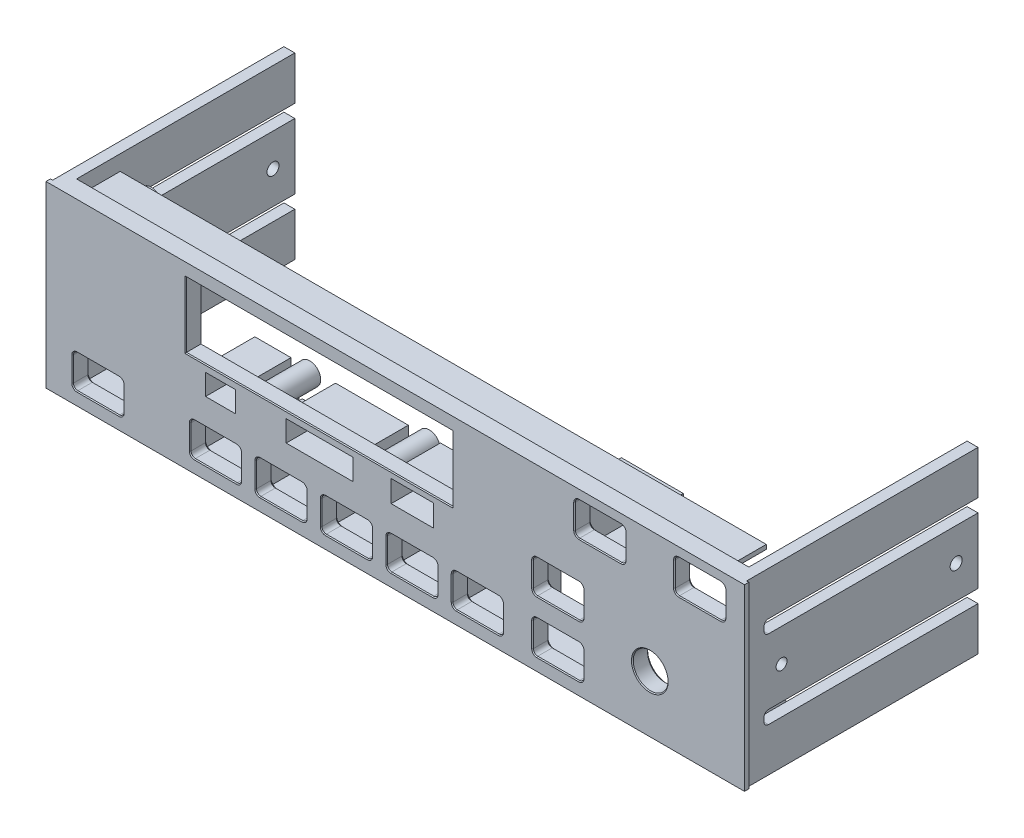
from build123d import *

# Parameters (mm, degrees)
ESQUISSE1_W             = 160
ESQUISSE1_H             = 41
BOSS_EXTRU_1_DEPTH      = 4
ESQUISSE2_R             = 4
ENL_V_MAT_EXTRU_1_DEPTH = 4
ESQUISSE4_W             = 3
ESQUISSE4_H             = 41
BOSS_EXTRU_2_DEPTH      = 50
ENL_V_MAT_EXTRU_2_DEPTH = 173.571724219
CHANFREIN1_SIZE         = 0.2
ESQUISSE9_R             = 1.25
ESQUISSE9_R_2           = 1.375
ENL_V_MAT_EXTRU_3_DEPTH = 900
ENL_V_START             = -1
ESQUISSE10_W            = 4.171279912
ESQUISSE10_H            = 57.921201065
ESQUISSE10_W_2          = 8.342559824
ESQUISSE10_H_2          = 64.595248924
ENL_V_MAT_EXTRU_5_DEPTH = 173.772840225
ESQUISSE11_W            = 14.2
ESQUISSE11_H            = 13.6
ESQUISSE11_W_2          = 12.8
ESQUISSE11_H_2          = 12.2
BOSS_EXTRU_4_DEPTH      = 8
ESQUISSE7_R             = 2.5
ESQUISSE7_R_2           = 1.25
BOSS_EXTRU_3_DEPTH      = 11
ESQUISSE7_3_R           = 2.5
ESQUISSE7_3_R_2         = 1.25
BOSS_EXTRU_12_DEPTH     = 10.5
ESQUISSE12_W            = 148
ESQUISSE12_H            = 1
BOSS_EXTRU_5_DEPTH      = 7
ESQUISSE14_W            = 8.279282425
ESQUISSE14_H            = 6.197970863
ESQUISSE14_W_2          = 6.879282425
ESQUISSE14_H_2          = 4.797970863
ESQUISSE14_W_3          = 16.678738338
ESQUISSE14_H_3          = 6.241410903
ESQUISSE14_W_4          = 15.278738338
ESQUISSE14_H_4          = 4.841410903
ESQUISSE14_W_5          = 11.14782764
ESQUISSE14_H_5          = 6.395979727
ESQUISSE14_W_6          = 9.74782764
ESQUISSE14_H_6          = 4.995979727
BOSS_EXTRU_7_DEPTH      = 8
ESQUISSE15_W            = 9.74782764
ESQUISSE15_H            = 4.995979727
ESQUISSE15_W_2          = 15.278738338
ESQUISSE15_H_2          = 4.841410903
ESQUISSE15_W_3          = 6.879282425
ESQUISSE15_H_3          = 4.797970863
ENL_V_MAT_EXTRU_7_DEPTH = 3.7
CHANFREIN2_SIZE         = 0.5
ESQUISSE16_W            = 6.879282425
ESQUISSE16_H            = 4.797970863
ESQUISSE16_W_2          = 15.278738338
ESQUISSE16_H_2          = 4.841410903
ESQUISSE16_W_3          = 9.74782764
ESQUISSE16_H_3          = 4.995979727
ENL_V_MAT_EXTRU_8_DEPTH = 10


with BuildPart() as part:
    # Esquisse1 → Boss.-Extru.1 (new body)
    with BuildSketch(Plane.XY):
        with Locations((80, 20.5)):
            Rectangle(ESQUISSE1_W, ESQUISSE1_H)
    extrude(amount=BOSS_EXTRU_1_DEPTH)

    # Esquisse2 → Enlèv. mat.-Extru.1 (cut)
    with BuildSketch(Plane.XY.offset(4)):
        with Locations((138.32, 13)):
            Circle(ESQUISSE2_R)
        with BuildLine():
            Line((7.1, 2.95), (16.7, 2.95))
            ThreePointArc((16.7, 2.95), (17.407106781, 3.242893219), (17.7, 3.95))
            Line((17.7, 3.95), (17.7, 9.55))
            ThreePointArc((17.7, 9.55), (17.407106781, 10.257106781), (16.7, 10.55))
            Line((16.7, 10.55), (7.1, 10.55))
            ThreePointArc((7.1, 10.55), (6.392893219, 10.257106781), (6.1, 9.55))
            Line((6.1, 9.55), (6.1, 3.95))
            ThreePointArc((6.1, 3.95), (6.392893219, 3.242893219), (7.1, 2.95))
        make_face()
        with BuildLine():
            Line((49.030194036, 10.55), (58.630194036, 10.55))
            ThreePointArc((58.630194036, 10.55), (59.337300817, 10.257106781), (59.630194036, 9.55))
            Line((59.630194036, 9.55), (59.630194036, 3.95))
            ThreePointArc((59.630194036, 3.95), (59.337300817, 3.242893219), (58.630194036, 2.95))
            Line((58.630194036, 2.95), (49.030194036, 2.95))
            ThreePointArc((49.030194036, 2.95), (48.323087255, 3.242893219), (48.030194036, 3.95))
            Line((48.030194036, 3.95), (48.030194036, 9.55))
            ThreePointArc((48.030194036, 9.55), (48.323087255, 10.257106781), (49.030194036, 10.55))
        make_face()
        with BuildLine():
            Line((34.030194036, 10.55), (43.630194036, 10.55))
            ThreePointArc((43.630194036, 10.55), (44.337300817, 10.257106781), (44.630194036, 9.55))
            Line((44.630194036, 9.55), (44.630194036, 3.95))
            ThreePointArc((44.630194036, 3.95), (44.337300817, 3.242893219), (43.630194036, 2.95))
            Line((43.630194036, 2.95), (34.030194036, 2.95))
            ThreePointArc((34.030194036, 2.95), (33.323087255, 3.242893219), (33.030194036, 3.95))
            Line((33.030194036, 3.95), (33.030194036, 9.55))
            ThreePointArc((33.030194036, 9.55), (33.323087255, 10.257106781), (34.030194036, 10.55))
        make_face()
        with BuildLine():
            Line((64.030194036, 10.55), (73.630194036, 10.55))
            ThreePointArc((73.630194036, 10.55), (74.337300817, 10.257106781), (74.630194036, 9.55))
            Line((74.630194036, 9.55), (74.630194036, 3.95))
            ThreePointArc((74.630194036, 3.95), (74.337300817, 3.242893219), (73.630194036, 2.95))
            Line((73.630194036, 2.95), (64.030194036, 2.95))
            ThreePointArc((64.030194036, 2.95), (63.323087255, 3.242893219), (63.030194036, 3.95))
            Line((63.030194036, 3.95), (63.030194036, 9.55))
            ThreePointArc((63.030194036, 9.55), (63.323087255, 10.257106781), (64.030194036, 10.55))
        make_face()
        with BuildLine():
            Line((79.030194036, 10.55), (88.630194036, 10.55))
            ThreePointArc((88.630194036, 10.55), (89.337300817, 10.257106781), (89.630194036, 9.55))
            Line((89.630194036, 9.55), (89.630194036, 3.95))
            ThreePointArc((89.630194036, 3.95), (89.337300817, 3.242893219), (88.630194036, 2.95))
            Line((88.630194036, 2.95), (79.030194036, 2.95))
            ThreePointArc((79.030194036, 2.95), (78.323087255, 3.242893219), (78.030194036, 3.95))
            Line((78.030194036, 3.95), (78.030194036, 9.55))
            ThreePointArc((78.030194036, 9.55), (78.323087255, 10.257106781), (79.030194036, 10.55))
        make_face()
        with BuildLine():
            Line((112.45409437, 10.55), (122.05409437, 10.55))
            ThreePointArc((122.05409437, 10.55), (122.761201151, 10.257106781), (123.05409437, 9.55))
            Line((123.05409437, 9.55), (123.05409437, 3.95))
            ThreePointArc((123.05409437, 3.95), (122.761201151, 3.242893219), (122.05409437, 2.95))
            Line((122.05409437, 2.95), (112.45409437, 2.95))
            ThreePointArc((112.45409437, 2.95), (111.746987589, 3.242893219), (111.45409437, 3.95))
            Line((111.45409437, 3.95), (111.45409437, 9.55))
            ThreePointArc((111.45409437, 9.55), (111.746987589, 10.257106781), (112.45409437, 10.55))
        make_face()
        with BuildLine():
            Line((122.089585492, 31.2), (131.689585492, 31.2))
            ThreePointArc((131.689585492, 31.2), (132.396692273, 31.492893219), (132.689585492, 32.2))
            Line((132.689585492, 32.2), (132.689585492, 37.8))
            ThreePointArc((132.689585492, 37.8), (132.396692273, 38.507106781), (131.689585492, 38.8))
            Line((131.689585492, 38.8), (122.089585492, 38.8))
            ThreePointArc((122.089585492, 38.8), (121.382478711, 38.507106781), (121.089585492, 37.8))
            Line((121.089585492, 37.8), (121.089585492, 32.2))
            ThreePointArc((121.089585492, 32.2), (121.382478711, 31.492893219), (122.089585492, 31.2))
        make_face()
        with BuildLine():
            Line((144.95, 31.2), (154.55, 31.2))
            ThreePointArc((154.55, 31.2), (155.257106781, 31.492893219), (155.55, 32.2))
            Line((155.55, 32.2), (155.55, 37.8))
            ThreePointArc((155.55, 37.8), (155.257106781, 38.507106781), (154.55, 38.8))
            Line((154.55, 38.8), (144.95, 38.8))
            ThreePointArc((144.95, 38.8), (144.242893219, 38.507106781), (143.95, 37.8))
            Line((143.95, 37.8), (143.95, 32.2))
            ThreePointArc((143.95, 32.2), (144.242893219, 31.492893219), (144.95, 31.2))
        make_face()
        with BuildLine():
            Line((112.45409437, 22.55), (122.05409437, 22.55))
            ThreePointArc((122.05409437, 22.55), (122.761201151, 22.257106781), (123.05409437, 21.55))
            Line((123.05409437, 21.55), (123.05409437, 15.95))
            ThreePointArc((123.05409437, 15.95), (122.761201151, 15.242893219), (122.05409437, 14.95))
            Line((122.05409437, 14.95), (112.45409437, 14.95))
            ThreePointArc((112.45409437, 14.95), (111.746987589, 15.242893219), (111.45409437, 15.95))
            Line((111.45409437, 15.95), (111.45409437, 21.55))
            ThreePointArc((111.45409437, 21.55), (111.746987589, 22.257106781), (112.45409437, 22.55))
        make_face()
        Polygon((32, 38), (63.5, 38), (93, 38), (93, 23), (63.5, 23), (32, 23), align=None)
        with BuildLine():
            Line((94.030194036, 10.55), (103.630194036, 10.55))
            ThreePointArc((103.630194036, 10.55), (104.337300817, 10.257106781), (104.630194036, 9.55))
            Line((104.630194036, 9.55), (104.630194036, 3.95))
            ThreePointArc((104.630194036, 3.95), (104.337300817, 3.242893219), (103.630194036, 2.95))
            Line((103.630194036, 2.95), (94.030194036, 2.95))
            ThreePointArc((94.030194036, 2.95), (93.323087255, 3.242893219), (93.030194036, 3.95))
            Line((93.030194036, 3.95), (93.030194036, 9.55))
            ThreePointArc((93.030194036, 9.55), (93.323087255, 10.257106781), (94.030194036, 10.55))
        make_face()
    extrude(amount=-ENL_V_MAT_EXTRU_1_DEPTH, mode=Mode.SUBTRACT)

    # Esquisse4 → Boss.-Extru.2 (add)
    with BuildSketch(Plane(origin=(0, 0, 0), x_dir=(-1, 0, 0), z_dir=(0, 0, -1))):
        with Locations((-158.5, 20.5)):
            Rectangle(ESQUISSE4_W, ESQUISSE4_H)
        with Locations((-1.5, 20.5)):
            Rectangle(ESQUISSE4_W, ESQUISSE4_H)
    extrude(amount=BOSS_EXTRU_2_DEPTH)

    # Esquisse5 → Enlèv. mat.-Extru.2 (cut, through all)
    with BuildSketch(Plane(origin=(160, 0, 0), x_dir=(0, 0, -1), z_dir=(1, 0, 0))):
        with BuildLine():
            Line((50, 13), (2, 13))
            ThreePointArc((2, 13), (1.292893219, 12.707106781), (1, 12))
            Line((1, 12), (1, 11))
            ThreePointArc((1, 11), (1.292893219, 10.292893219), (2, 10))
            Line((2, 10), (50, 10))
            Line((50, 10), (50, 13))
        make_face()
        with BuildLine():
            Line((50, 31), (2, 31))
            ThreePointArc((2, 31), (1.292893219, 30.707106781), (1, 30))
            Line((1, 30), (1, 29))
            ThreePointArc((1, 29), (1.292893219, 28.292893219), (2, 28))
            Line((2, 28), (50, 28))
            Line((50, 28), (50, 31))
        make_face()
    extrude(amount=-ENL_V_MAT_EXTRU_2_DEPTH, mode=Mode.SUBTRACT)

    # Chanfrein1
    chanfrein1_edges = [part.edges().sort_by_distance(p)[0] for p in [
        (93, 30.5, 4),
        (62.5, 23, 4),
        (32, 30.5, 4),
        (62.5, 38, 4),
        (149.75, 31.2, 4),
        (155.257106781, 31.492893219, 4),
        (144.242893219, 31.492893219, 4),
        (155.55, 35, 4),
        (143.95, 35, 4),
        (155.257106781, 38.507106781, 4),
        (144.242893219, 38.507106781, 4),
        (149.75, 38.8, 4),
        (126.889585492, 31.2, 4),
        (132.396692273, 31.492893219, 4),
        (121.382478711, 31.492893219, 4),
        (132.689585492, 35, 4),
        (121.089585492, 35, 4),
        (132.396692273, 38.507106781, 4),
        (121.382478711, 38.507106781, 4),
        (126.889585492, 38.8, 4),
        (11.9, 2.95, 4),
        (17.407106781, 3.242893219, 4),
        (6.392893219, 3.242893219, 4),
        (17.7, 6.75, 4),
        (6.1, 6.75, 4),
        (17.407106781, 10.257106781, 4),
        (6.392893219, 10.257106781, 4),
        (11.9, 10.55, 4),
        (134.32, 13, 4),
        (123.05409437, 18.75, 4),
        (122.761201151, 22.257106781, 4),
        (122.761201151, 15.242893219, 4),
        (117.25409437, 22.55, 4),
        (117.25409437, 14.95, 4),
        (111.746987589, 22.257106781, 4),
        (111.746987589, 15.242893219, 4),
        (111.45409437, 18.75, 4),
        (123.05409437, 6.75, 4),
        (122.761201151, 10.257106781, 4),
        (122.761201151, 3.242893219, 4),
        (117.25409437, 10.55, 4),
        (117.25409437, 2.95, 4),
        (111.746987589, 10.257106781, 4),
        (111.746987589, 3.242893219, 4),
        (111.45409437, 6.75, 4),
        (104.630194036, 6.75, 4),
        (104.337300817, 10.257106781, 4),
        (104.337300817, 3.242893219, 4),
        (98.830194036, 10.55, 4),
        (98.830194036, 2.95, 4),
        (93.323087255, 10.257106781, 4),
        (93.323087255, 3.242893219, 4),
        (93.030194036, 6.75, 4),
        (89.630194036, 6.75, 4),
        (89.337300817, 10.257106781, 4),
        (89.337300817, 3.242893219, 4),
        (83.830194036, 10.55, 4),
        (83.830194036, 2.95, 4),
        (78.323087255, 10.257106781, 4),
        (78.323087255, 3.242893219, 4),
        (78.030194036, 6.75, 4),
        (74.630194036, 6.75, 4),
        (74.337300817, 10.257106781, 4),
        (74.337300817, 3.242893219, 4),
        (68.830194036, 10.55, 4),
        (68.830194036, 2.95, 4),
        (63.323087255, 10.257106781, 4),
        (63.323087255, 3.242893219, 4),
        (63.030194036, 6.75, 4),
        (59.630194036, 6.75, 4),
        (59.337300817, 10.257106781, 4),
        (59.337300817, 3.242893219, 4),
        (53.830194036, 10.55, 4),
        (53.830194036, 2.95, 4),
        (48.323087255, 10.257106781, 4),
        (48.323087255, 3.242893219, 4),
        (48.030194036, 6.75, 4),
        (44.630194036, 6.75, 4),
        (44.337300817, 10.257106781, 4),
        (44.337300817, 3.242893219, 4),
        (38.830194036, 10.55, 4),
        (38.830194036, 2.95, 4),
        (33.323087255, 10.257106781, 4),
        (33.323087255, 3.242893219, 4),
        (33.030194036, 6.75, 4),
    ]]
    chamfer(chanfrein1_edges, length=CHANFREIN1_SIZE)

    # Esquisse9 → Enlèv. mat.-Extru.3 (cut)
    with BuildSketch(Plane(origin=(160, 0, 0), x_dir=(0, 0, -1), z_dir=(1, 0, 0))):
        with Locations((5, 20.5)):
            Circle(ESQUISSE9_R)
        with Locations((45, 20.5)):
            Circle(ESQUISSE9_R_2)
    extrude(amount=-ENL_V_MAT_EXTRU_3_DEPTH, mode=Mode.SUBTRACT)

    # Esquisse10 → Enlèv. mat.-Extru.5 (cut, through all)
    with BuildSketch(Plane.XY.offset(4).offset(ENL_V_START)):
        with Locations((-1.585639956, 24.108169502)):
            Rectangle(ESQUISSE10_W, ESQUISSE10_H)
        with Locations((163.671279912, 22.797195815)):
            Rectangle(ESQUISSE10_W_2, ESQUISSE10_H_2)
    extrude(amount=-ENL_V_MAT_EXTRU_5_DEPTH, mode=Mode.SUBTRACT)

    # Esquisse11 → Boss.-Extru.4 (add)
    # profile 1 of 7: a face of its own
    with BuildSketch(Plane(origin=(0, 0, 0), x_dir=(-1, 0, 0), z_dir=(0, 0, -1))):
        with Locations((-11.9, 8.45)):
            Rectangle(ESQUISSE11_W, ESQUISSE11_H)
        with Locations((-11.9, 8.45)):
            Rectangle(ESQUISSE11_W_2, ESQUISSE11_H_2, mode=Mode.SUBTRACT)
    # profile 2 of 7: a face of its own
    with BuildSketch(Plane(origin=(0, 0, 0), x_dir=(-1, 0, 0), z_dir=(0, 0, -1))):
        with Locations((-38.830194036, 8.45)):
            Rectangle(ESQUISSE11_W, ESQUISSE11_H)
        with Locations((-38.830194036, 8.45)):
            Rectangle(ESQUISSE11_W_2, ESQUISSE11_H_2, mode=Mode.SUBTRACT)
    # profile 3 of 7: a face of its own
    with BuildSketch(Plane(origin=(0, 0, 0), x_dir=(-1, 0, 0), z_dir=(0, 0, -1))):
        with Locations((-53.830194036, 8.45)):
            Rectangle(ESQUISSE11_W, ESQUISSE11_H)
        with Locations((-53.830194036, 8.45)):
            Rectangle(ESQUISSE11_W_2, ESQUISSE11_H_2, mode=Mode.SUBTRACT)
    # profile 4 of 7: a face of its own
    with BuildSketch(Plane(origin=(0, 0, 0), x_dir=(-1, 0, 0), z_dir=(0, 0, -1))):
        with Locations((-68.830194036, 8.45)):
            Rectangle(ESQUISSE11_W, ESQUISSE11_H)
        with Locations((-68.830194036, 8.45)):
            Rectangle(ESQUISSE11_W_2, ESQUISSE11_H_2, mode=Mode.SUBTRACT)
    # profile 5 of 7: a face of its own
    with BuildSketch(Plane(origin=(0, 0, 0), x_dir=(-1, 0, 0), z_dir=(0, 0, -1))):
        with Locations((-83.830194036, 8.45)):
            Rectangle(ESQUISSE11_W, ESQUISSE11_H)
        with Locations((-83.830194036, 8.45)):
            Rectangle(ESQUISSE11_W_2, ESQUISSE11_H_2, mode=Mode.SUBTRACT)
    # profile 6 of 7: a face of its own
    with BuildSketch(Plane(origin=(0, 0, 0), x_dir=(-1, 0, 0), z_dir=(0, 0, -1))):
        with Locations((-98.830194036, 8.45)):
            Rectangle(ESQUISSE11_W, ESQUISSE11_H)
        with Locations((-98.830194036, 8.45)):
            Rectangle(ESQUISSE11_W_2, ESQUISSE11_H_2, mode=Mode.SUBTRACT)
    # profile 7 of 7: a face of its own
    with BuildSketch(Plane(origin=(0, 0, 0), x_dir=(-1, 0, 0), z_dir=(0, 0, -1))):
        with Locations((-126.889585492, 33.3)):
            Rectangle(ESQUISSE11_W, ESQUISSE11_H)
        with Locations((-126.889585492, 33.3)):
            Rectangle(ESQUISSE11_W_2, ESQUISSE11_H_2, mode=Mode.SUBTRACT)
    extrude(amount=BOSS_EXTRU_4_DEPTH)

    # Esquisse7 → Boss.-Extru.3 (add)
    # profile 1 of 4: a face of its own
    with BuildSketch(Plane(origin=(0, 0, 0), x_dir=(-1, 0, 0), z_dir=(0, 0, -1))):
        with Locations((-9.121504758, 34.424873109)):
            Circle(ESQUISSE7_R)
        with Locations((-9.121504758, 34.424873109)):
            Circle(ESQUISSE7_R_2, mode=Mode.SUBTRACT)
    # profile 2 of 4: a face of its own
    with BuildSketch(Plane(origin=(0, 0, 0), x_dir=(-1, 0, 0), z_dir=(0, 0, -1))):
        with Locations((-24.98168427, 6.75)):
            Circle(ESQUISSE7_R)
        with Locations((-24.98168427, 6.75)):
            Circle(ESQUISSE7_R_2, mode=Mode.SUBTRACT)
    # profile 3 of 4: a face of its own
    with BuildSketch(Plane(origin=(0, 0, 0), x_dir=(-1, 0, 0), z_dir=(0, 0, -1))):
        with Locations((-138.246159037, 33.067084724)):
            Circle(ESQUISSE7_R)
        with Locations((-138.246159037, 33.067084724)):
            Circle(ESQUISSE7_R_2, mode=Mode.SUBTRACT)
    # profile 4 of 4: a face of its own
    with BuildSketch(Plane(origin=(0, 0, 0), x_dir=(-1, 0, 0), z_dir=(0, 0, -1))):
        with Locations((-152.183195484, 6.75)):
            Circle(ESQUISSE7_R)
        with Locations((-152.183195484, 6.75)):
            Circle(ESQUISSE7_R_2, mode=Mode.SUBTRACT)
    extrude(amount=BOSS_EXTRU_3_DEPTH)

    # Esquisse7<3> → Boss.-Extru.12 (add)
    # profile 1 of 7: a face of its own
    with BuildSketch(Plane(origin=(0, 0, 0), x_dir=(-1, 0, 0), z_dir=(0, 0, -1))):
        with Locations((-9.121504758, 34.424873109)):
            Circle(ESQUISSE7_3_R)
        with Locations((-9.121504758, 34.424873109)):
            Circle(ESQUISSE7_3_R_2, mode=Mode.SUBTRACT)
    # profile 2 of 7: a face of its own
    with BuildSketch(Plane(origin=(0, 0, 0), x_dir=(-1, 0, 0), z_dir=(0, 0, -1))):
        with Locations((-24.98168427, 6.75)):
            Circle(ESQUISSE7_3_R)
        with Locations((-24.98168427, 6.75)):
            Circle(ESQUISSE7_3_R_2, mode=Mode.SUBTRACT)
    # profile 3 of 7: a face of its own
    with BuildSketch(Plane(origin=(0, 0, 0), x_dir=(-1, 0, 0), z_dir=(0, 0, -1))):
        with Locations((-138.246159037, 33.067084724)):
            Circle(ESQUISSE7_3_R)
        with Locations((-138.246159037, 33.067084724)):
            Circle(ESQUISSE7_3_R_2, mode=Mode.SUBTRACT)
    # profile 4 of 7: a face of its own
    with BuildSketch(Plane(origin=(0, 0, 0), x_dir=(-1, 0, 0), z_dir=(0, 0, -1))):
        with Locations((-152.183195484, 6.75)):
            Circle(ESQUISSE7_3_R)
        with Locations((-152.183195484, 6.75)):
            Circle(ESQUISSE7_3_R_2, mode=Mode.SUBTRACT)
    # profile 5 of 7: a face of its own
    with BuildSketch(Plane(origin=(0, 0, 0), x_dir=(-1, 0, 0), z_dir=(0, 0, -1))):
        with Locations((-73.299586821, 18.635920155)):
            Circle(ESQUISSE7_3_R)
        with Locations((-73.299586821, 18.635920155)):
            Circle(ESQUISSE7_3_R_2, mode=Mode.SUBTRACT)
    # profile 6 of 7: a face of its own
    with BuildSketch(Plane(origin=(0, 0, 0), x_dir=(-1, 0, 0), z_dir=(0, 0, -1))):
        with Locations((-103.528260194, 18.635920155)):
            Circle(ESQUISSE7_3_R)
        with Locations((-103.528260194, 18.635920155)):
            Circle(ESQUISSE7_3_R_2, mode=Mode.SUBTRACT)
    # profile 7 of 7: a face of its own
    with BuildSketch(Plane(origin=(0, 0, 0), x_dir=(-1, 0, 0), z_dir=(0, 0, -1))):
        with Locations((-45.928753513, 18.635920155)):
            Circle(ESQUISSE7_3_R)
        with Locations((-45.928753513, 18.635920155)):
            Circle(ESQUISSE7_3_R_2, mode=Mode.SUBTRACT)
    extrude(amount=BOSS_EXTRU_12_DEPTH)

    # Esquisse12 → Boss.-Extru.5 (add)
    with BuildSketch(Plane(origin=(0, 0, 0), x_dir=(-1, 0, 0), z_dir=(0, 0, -1))):
        with Locations((-80, 40)):
            Rectangle(ESQUISSE12_W, ESQUISSE12_H)
        with Locations((-80, 1)):
            Rectangle(ESQUISSE12_W, ESQUISSE12_H)
    extrude(amount=BOSS_EXTRU_5_DEPTH)

    # Esquisse14 → Boss.-Extru.7 (add)
    # profile 1 of 3: a face of its own
    with BuildSketch(Plane(origin=(0, 0, 0), x_dir=(-1, 0, 0), z_dir=(0, 0, -1))):
        with Locations((-39.983624666, 19.009843626)):
            Rectangle(ESQUISSE14_W, ESQUISSE14_H)
        with Locations((-39.983624666, 19.009843626)):
            Rectangle(ESQUISSE14_W_2, ESQUISSE14_H_2, mode=Mode.SUBTRACT)
    # profile 2 of 3: a face of its own
    with BuildSketch(Plane(origin=(0, 0, 0), x_dir=(-1, 0, 0), z_dir=(0, 0, -1))):
        with Locations((-62.664411353, 19.031563646)):
            Rectangle(ESQUISSE14_W_3, ESQUISSE14_H_3)
        with Locations((-62.664411353, 19.031563646)):
            Rectangle(ESQUISSE14_W_4, ESQUISSE14_H_4, mode=Mode.SUBTRACT)
    # profile 3 of 3: a face of its own
    with BuildSketch(Plane(origin=(0, 0, 0), x_dir=(-1, 0, 0), z_dir=(0, 0, -1))):
        with Locations((-83.939853259, 19.108848058)):
            Rectangle(ESQUISSE14_W_5, ESQUISSE14_H_5)
        with Locations((-83.939853259, 19.108848058)):
            Rectangle(ESQUISSE14_W_6, ESQUISSE14_H_6, mode=Mode.SUBTRACT)
    extrude(amount=BOSS_EXTRU_7_DEPTH)

    # Esquisse15 → Enlèv. mat.-Extru.7 (cut)
    with BuildSketch(Plane(origin=(0, 0, 0), x_dir=(-1, 0, 0), z_dir=(0, 0, -1))):
        with Locations((-83.939853259, 19.108848058)):
            Rectangle(ESQUISSE15_W, ESQUISSE15_H)
        with Locations((-62.664411353, 19.031563646)):
            Rectangle(ESQUISSE15_W_2, ESQUISSE15_H_2)
        with Locations((-39.983624666, 19.009843626)):
            Rectangle(ESQUISSE15_W_3, ESQUISSE15_H_3)
    extrude(amount=-ENL_V_MAT_EXTRU_7_DEPTH, mode=Mode.SUBTRACT)

    # Chanfrein2
    chanfrein2_edges = [part.edges().sort_by_distance(p)[0] for p in [
        (32, 30.5, 0),
        (62.5, 38, 0),
        (93, 30.5, 0),
        (62.5, 23, 0),
        (11.9, 2.95, 0),
        (17.407106781, 3.242893219, 0),
        (6.392893219, 3.242893219, 0),
        (17.7, 6.75, 0),
        (6.1, 6.75, 0),
        (17.407106781, 10.257106781, 0),
        (6.392893219, 10.257106781, 0),
        (11.9, 10.55, 0),
        (38.830194036, 2.95, 0),
        (44.337300817, 3.242893219, 0),
        (33.323087255, 3.242893219, 0),
        (44.630194036, 6.75, 0),
        (33.030194036, 6.75, 0),
        (44.337300817, 10.257106781, 0),
        (33.323087255, 10.257106781, 0),
        (38.830194036, 10.55, 0),
        (53.830194036, 2.95, 0),
        (59.337300817, 3.242893219, 0),
        (48.323087255, 3.242893219, 0),
        (59.630194036, 6.75, 0),
        (48.030194036, 6.75, 0),
        (59.337300817, 10.257106781, 0),
        (48.323087255, 10.257106781, 0),
        (53.830194036, 10.55, 0),
        (68.830194036, 2.95, 0),
        (74.337300817, 3.242893219, 0),
        (63.323087255, 3.242893219, 0),
        (74.630194036, 6.75, 0),
        (63.030194036, 6.75, 0),
        (74.337300817, 10.257106781, 0),
        (63.323087255, 10.257106781, 0),
        (68.830194036, 10.55, 0),
        (83.830194036, 2.95, 0),
        (89.337300817, 3.242893219, 0),
        (78.323087255, 3.242893219, 0),
        (89.630194036, 6.75, 0),
        (78.030194036, 6.75, 0),
        (89.337300817, 10.257106781, 0),
        (78.323087255, 10.257106781, 0),
        (83.830194036, 10.55, 0),
        (98.830194036, 10.55, 0),
        (93.323087255, 10.257106781, 0),
        (104.337300817, 10.257106781, 0),
        (93.030194036, 6.75, 0),
        (104.630194036, 6.75, 0),
        (93.323087255, 3.242893219, 0),
        (104.337300817, 3.242893219, 0),
        (98.830194036, 2.95, 0),
        (117.25409437, 10.55, 0),
        (111.746987589, 10.257106781, 0),
        (122.761201151, 10.257106781, 0),
        (111.45409437, 6.75, 0),
        (123.05409437, 6.75, 0),
        (111.746987589, 3.242893219, 0),
        (122.761201151, 3.242893219, 0),
        (117.25409437, 2.95, 0),
        (134.32, 13, 0),
        (117.25409437, 22.55, 0),
        (111.746987589, 22.257106781, 0),
        (122.761201151, 22.257106781, 0),
        (111.45409437, 18.75, 0),
        (123.05409437, 18.75, 0),
        (111.746987589, 15.242893219, 0),
        (122.761201151, 15.242893219, 0),
        (117.25409437, 14.95, 0),
        (126.889585492, 38.8, 0),
        (121.382478711, 38.507106781, 0),
        (132.396692273, 38.507106781, 0),
        (121.089585492, 35, 0),
        (132.689585492, 35, 0),
        (121.382478711, 31.492893219, 0),
        (132.396692273, 31.492893219, 0),
        (126.889585492, 31.2, 0),
        (149.75, 38.8, 0),
        (144.242893219, 38.507106781, 0),
        (155.257106781, 38.507106781, 0),
        (143.95, 35, 0),
        (155.55, 35, 0),
        (144.242893219, 31.492893219, 0),
        (155.257106781, 31.492893219, 0),
        (149.75, 31.2, 0),
    ]]
    chamfer(chanfrein2_edges, length=CHANFREIN2_SIZE)

    # Esquisse16 → Enlèv. mat.-Extru.8 (cut)
    with BuildSketch(Plane.XY.offset(4)):
        with Locations((39.983624666, 19.009843626)):
            Rectangle(ESQUISSE16_W, ESQUISSE16_H)
        with Locations((62.664411353, 19.031563646)):
            Rectangle(ESQUISSE16_W_2, ESQUISSE16_H_2)
        with Locations((83.939853259, 19.108848058)):
            Rectangle(ESQUISSE16_W_3, ESQUISSE16_H_3)
    extrude(amount=-ENL_V_MAT_EXTRU_8_DEPTH, mode=Mode.SUBTRACT)


solid = part.part
